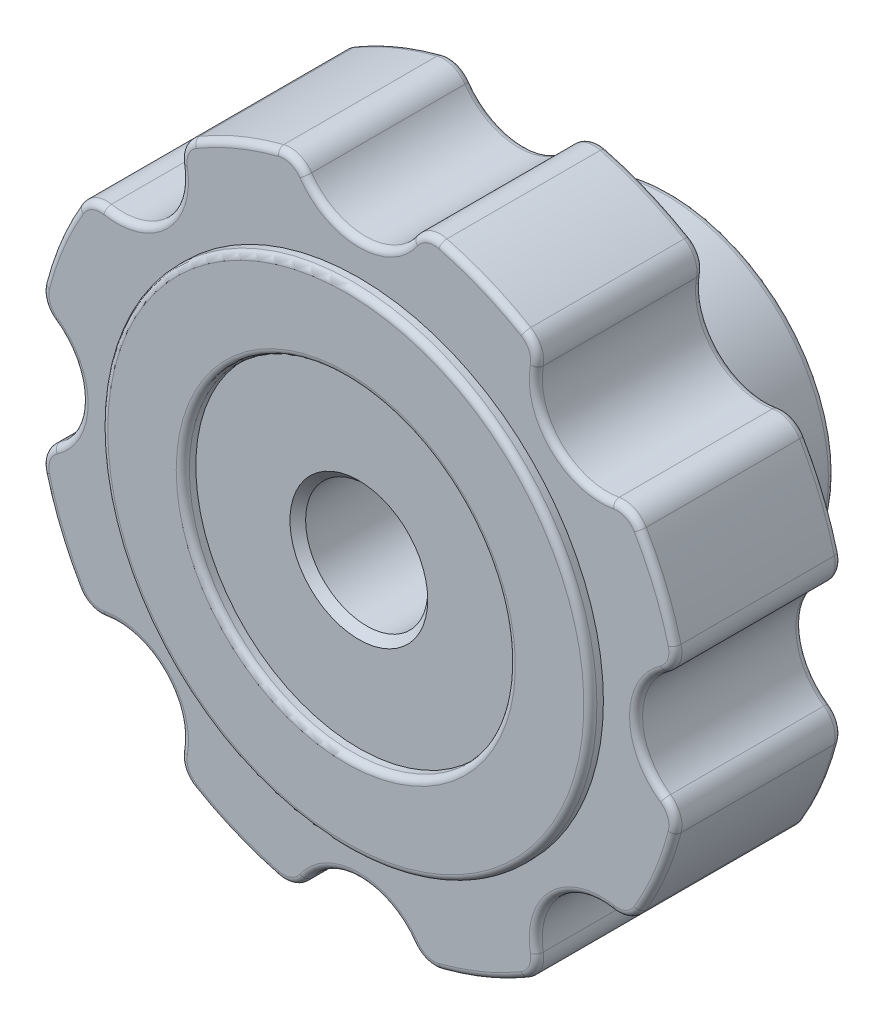
from build123d import *

# Parameters (mm, degrees)
SKETCH1_W                = 30.48
SKETCH1_H                = 3.96875
LPATTERN1_COUNT          = 22
LPATTERN1_PITCH          = 1.411111111
LPATTERN1_COL_COUNT      = 2
LPATTERN1_COL_PITCH      = 1.411111111
SKETCH9_W                = 30.48
SKETCH9_H                = 4.674305556
CUT_EXTRUDE1_DEPTH       = 16.1925
FILLET1_R                = 2.54
CIRPATTERN1_COUNT        = 8
FILLET1_OF_CIRPATTERN1_R = 2.54
FILLET2_R                = 0.635
SKETCH11_R               = 5.944305556
CUT_EXTRUDE2_DEPTH       = 47.954295766
CHAMFER1_SIZE            = 0.762


with BuildPart() as part:
    # Sketch1 → Revolve1 (revolve)
    with BuildSketch(Plane(origin=(0, 0, 0), x_dir=(0, 0, -1), z_dir=(1, 0, 0))):
        with Locations((0, 1.984375)):
            Rectangle(SKETCH1_W, SKETCH1_H)
    revolve(axis=Axis((0, 0, 8.5598), (0, 0, 1)))

    # Sketch2 → Cut-Revolve1 (revolve, cut)
    with BuildSketch(Plane(origin=(0, 0, 0), x_dir=(0, 0, -1), z_dir=(1, 0, 0)), mode=Mode.PRIVATE) as cut_revolve1_sk:
        Polygon((-15.066334113, 3.999623935), (-13.850672906, 4.215741483), (-14.151149561, 3.386561296), (-14.498481334, 3.324813425), align=None)
    cut_revolve1 = revolve(cut_revolve1_sk.sketch.rotate(Axis((0, -0.268755768, 15.24), (0, 0.17503333471749488, -0.9845625077859066)), 180), axis=Axis((0, -0.268755768, 15.24), (0, 0.17503333471749488, -0.9845625077859066)), mode=Mode.SUBTRACT)

    # LPattern1: Cut-Revolve1 ×22
    with Locations(*[(0, 0, -i * LPATTERN1_PITCH) for i in range(1, LPATTERN1_COUNT)]):
        add(cut_revolve1, mode=Mode.SUBTRACT)

    # LPattern1 col: Cut-Revolve1 ×2
    with Locations(*[(0, 0, i * LPATTERN1_COL_PITCH) for i in range(1, LPATTERN1_COL_COUNT)]):
        add(cut_revolve1, mode=Mode.SUBTRACT)


with BuildPart() as body_2:
    # Sketch9 → Revolve4 (revolve)
    with BuildSketch(Plane(origin=(0, 0, 0), x_dir=(0, 0, -1), z_dir=(1, 0, 0)), mode=Mode.PRIVATE) as revolve4_sk:
        with Locations((0, 2.337152778)):
            Rectangle(SKETCH9_W, SKETCH9_H)
    revolve(revolve4_sk.sketch.rotate(Axis((0, 0, -15.24), (0, 0, 1)), 143.616284107), axis=Axis((0, 0, -15.24), (0, 0, 1)))

    # Combine4: read off the stored shape, not the designer's step
    # Combine4: cut part
    add(part.part, mode=Mode.SUBTRACT)

    # Sketch10 → Cut-Revolve2 (revolve, cut)
    with BuildSketch(Plane(origin=(0, 0, 0), x_dir=(0, 0, -1), z_dir=(1, 0, 0)), mode=Mode.PRIVATE) as cut_revolve2_sk:
        Polygon((-15.24, 0), (-15.24, 3.96875), (-14.534444444, 3.263194444), (-14.534444444, 0), align=None)
        Polygon((14.534444444, 3.263194444), (14.534444444, 0), (15.24, 0), (15.24, 3.96875), align=None)
    revolve(cut_revolve2_sk.sketch.rotate(Axis((0, 0, -15.24), (0, 0, 1)), 143.616284107), axis=Axis((0, 0, -15.24), (0, 0, 1)), mode=Mode.SUBTRACT)


with BuildPart() as body_2_2:
    # Sketch5 → Revolve3 (revolve)
    with BuildSketch(Plane(origin=(0, 0, 0), x_dir=(0, 0, -1), z_dir=(1, 0, 0)), mode=Mode.PRIVATE) as revolve3_sk:
        Polygon((15.24, 15.875), (0.9525, 15.875), (0.9525, 31.75), (-15.24, 31.75), (-15.24, 23.8125), (-16.51, 23.8125), (-16.51, 15.875), (-15.24, 15.875), (-15.24, 4.674305556), (15.24, 4.674305556), align=None)
    revolve(revolve3_sk.sketch.rotate(Axis((0, 0, 15.24), (0, 0, -1)), 216.383715893), axis=Axis((0, 0, 15.24), (0, 0, -1)))

    # Sketch6 → Cut-Extrude1 (cut)
    with BuildSketch(Plane.XY.offset(15.24)):
        with BuildLine():
            Line((0, 33.3375), (0, 26.9875))
            ThreePointArc((0, 26.9875), (3.649770663, 28.141186489), (5.973339405, 31.183035714))
            ThreePointArc((5.973339405, 31.183035714), (12.150198978, 29.333175157), (17.825947212, 26.273524811))
            ThreePointArc((17.825947212, 26.273524811), (17.318046211, 22.479601382), (19.083044257, 19.083044257))
            Line((19.083044257, 19.083044257), (23.573172318, 23.573172318))
            ThreePointArc((23.573172318, 23.573172318), (12.810608281, 30.927544254), (0, 33.3375))
        make_face()
    cut_extrude1 = extrude(amount=-CUT_EXTRUDE1_DEPTH, mode=Mode.SUBTRACT)

    # Fillet1
    fillet1_edges = [body_2_2.edges().sort_by_distance(p)[0] for p in [
        (17.825947212, 26.273524811, 7.14375),
        (5.973339405, 31.183035714, 7.14375),
    ]]
    fillet(fillet1_edges, radius=FILLET1_R)

    # CirPattern1: Cut-Extrude1 ×8 about axis
    cirpattern1_axis = Axis((0, 0, 0), (0, 0, 1))
    for i in range(1, CIRPATTERN1_COUNT):
        add(cut_extrude1.rotate(cirpattern1_axis, i * 360 / CIRPATTERN1_COUNT), mode=Mode.SUBTRACT)

    # Fillet1 of CirPattern1
    fillet1_of_cirpattern1_edges = [body_2_2.edges().sort_by_distance(p)[0] for p in [
        (-5.973339405, 31.183035714, 7.14375),
        (-17.825947212, 26.273524811, 7.14375),
        (-26.273524811, 17.825947212, 7.14375),
        (-31.183035714, 5.973339405, 7.14375),
        (-31.183035714, -5.973339405, 7.14375),
        (-26.273524811, -17.825947212, 7.14375),
        (-17.825947212, -26.273524811, 7.14375),
        (-5.973339405, -31.183035714, 7.14375),
        (5.973339405, -31.183035714, 7.14375),
        (17.825947212, -26.273524811, 7.14375),
        (26.273524811, -17.825947212, 7.14375),
        (31.183035714, -5.973339405, 7.14375),
        (31.183035714, 5.973339405, 7.14375),
        (26.273524811, 17.825947212, 7.14375),
    ]]
    fillet(fillet1_of_cirpattern1_edges, radius=FILLET1_OF_CIRPATTERN1_R)

    # Fillet2
    fillet2_edges = [body_2_2.edges().sort_by_distance(p)[0] for p in [
        (0, 26.9875, 15.24),
        (-12.150198978, 29.333175157, 15.24),
        (-17.13697286, 26.2236958, 15.24),
        (-6.42528341, 30.660622846, 15.24),
        (-12.150198978, 29.333175157, -0.9525),
        (-19.083044257, 19.083044257, -0.9525),
        (-17.13697286, 26.2236958, -0.9525),
        (-6.42528341, 30.660622846, -0.9525),
        (-19.083044257, 19.083044257, 15.24),
        (-29.333175157, 12.150198978, 15.24),
        (-30.660622846, 6.42528341, 15.24),
        (-26.2236958, 17.13697286, 15.24),
        (-29.333175157, 12.150198978, -0.9525),
        (-26.9875, 0, -0.9525),
        (-30.660622846, 6.42528341, -0.9525),
        (-26.2236958, 17.13697286, -0.9525),
        (-26.9875, 0, 15.24),
        (-29.333175157, -12.150198978, 15.24),
        (-26.2236958, -17.13697286, 15.24),
        (-30.660622846, -6.42528341, 15.24),
        (-29.333175157, -12.150198978, -0.9525),
        (-19.083044257, -19.083044257, -0.9525),
        (-26.2236958, -17.13697286, -0.9525),
        (-30.660622846, -6.42528341, -0.9525),
        (-19.083044257, -19.083044257, 15.24),
        (-12.150198978, -29.333175157, 15.24),
        (-6.42528341, -30.660622846, 15.24),
        (-17.13697286, -26.2236958, 15.24),
        (-12.150198978, -29.333175157, -0.9525),
        (0, -26.9875, -0.9525),
        (-6.42528341, -30.660622846, -0.9525),
        (-17.13697286, -26.2236958, -0.9525),
        (0, -26.9875, 15.24),
        (12.150198978, -29.333175157, 15.24),
        (17.13697286, -26.2236958, 15.24),
        (6.42528341, -30.660622846, 15.24),
        (12.150198978, -29.333175157, -0.9525),
        (19.083044257, -19.083044257, -0.9525),
        (17.13697286, -26.2236958, -0.9525),
        (6.42528341, -30.660622846, -0.9525),
        (19.083044257, -19.083044257, 15.24),
        (29.333175157, -12.150198978, 15.24),
        (30.660622846, -6.42528341, 15.24),
        (26.2236958, -17.13697286, 15.24),
        (29.333175157, -12.150198978, -0.9525),
        (26.9875, 0, -0.9525),
        (30.660622846, -6.42528341, -0.9525),
        (26.2236958, -17.13697286, -0.9525),
        (26.9875, 0, 15.24),
        (29.333175157, 12.150198978, 15.24),
        (26.2236958, 17.13697286, 15.24),
        (30.660622846, 6.42528341, 15.24),
        (29.333175157, 12.150198978, -0.9525),
        (19.083044257, 19.083044257, -0.9525),
        (26.2236958, 17.13697286, -0.9525),
        (30.660622846, 6.42528341, -0.9525),
        (19.083044257, 19.083044257, 15.24),
        (12.150198978, 29.333175157, 15.24),
        (6.42528341, 30.660622846, 15.24),
        (17.13697286, 26.2236958, 15.24),
        (12.150198978, 29.333175157, -0.9525),
        (0, 26.9875, -0.9525),
        (6.42528341, 30.660622846, -0.9525),
        (17.13697286, 26.2236958, -0.9525),
        (9.416892881, 12.780365936, -15.24),
        (14.125339322, 19.170548905, 16.51),
        (9.416892881, 12.780365936, 16.51),
    ]]
    fillet(fillet2_edges, radius=FILLET2_R)


with BuildPart() as cut_extrude2_tool:
    # Sketch11 → Cut-Extrude2 (new, through all)
    with BuildSketch(Plane(origin=(0, 0, -0.9525), x_dir=(-1, 0, 0), z_dir=(0, 0, -1))):
        Circle(SKETCH11_R)
    extrude(amount=-CUT_EXTRUDE2_DEPTH)


with BuildPart() as body_2_1:
    add(body_2.part)

    # Cut-Extrude2: cut by cut_extrude2_tool
    add(cut_extrude2_tool.part, mode=Mode.SUBTRACT)


with BuildPart() as body_2_2_1:
    add(body_2_2.part)

    # Cut-Extrude2: cut by cut_extrude2_tool
    add(cut_extrude2_tool.part, mode=Mode.SUBTRACT)

    # Chamfer1
    chamfer1_edges = [body_2_2_1.edges().sort_by_distance(p)[0] for p in [
        (5.944305556, 0, 15.24),
    ]]
    chamfer(chamfer1_edges, length=CHAMFER1_SIZE)


solid = Compound([body_2_1.part, body_2_2_1.part])
